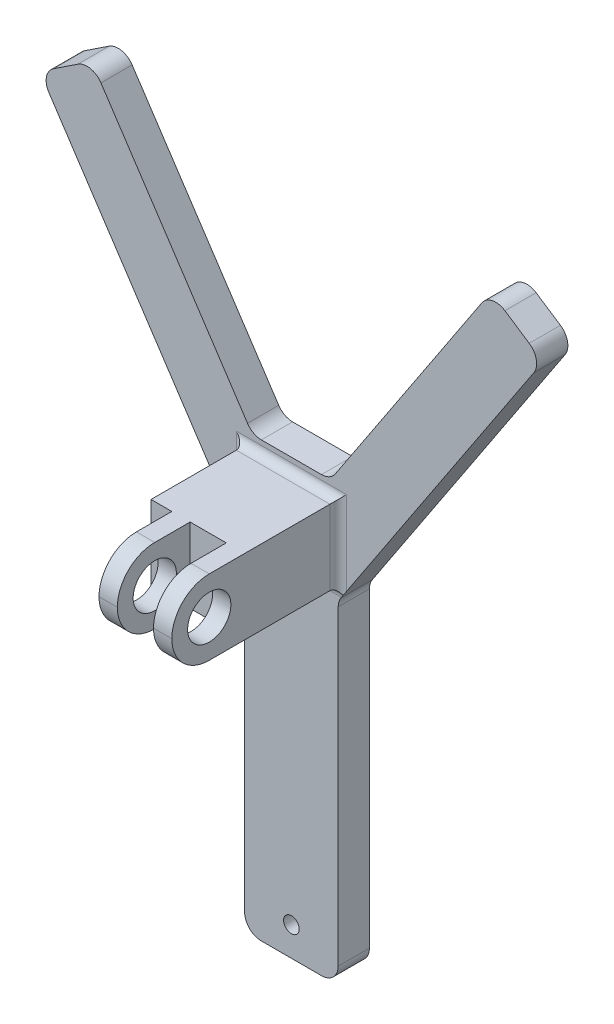
from build123d import *

# Parameters (mm, degrees)
BOSS_EXTRUDE1_DEPTH = 9.525
SKETCH3_W           = 28.575
SKETCH3_H           = 22.86
BOSS_EXTRUDE2_DEPTH = 50.8
FILLET1_R           = 5.08
SKETCH4_W           = 6.35
SKETCH4_H           = 22.225
SKETCH4_W_2         = 11.049
CUT_EXTRUDE1_DEPTH  = 143.837889922
FILLET3_R           = 11.43
SKETCH5_R           = 6.604
CUT_EXTRUDE2_DEPTH  = 172.690359797
SKETCH7_R           = 4.233333333
CUT_EXTRUDE3_DEPTH  = 5.08
SKETCH8_R           = 2.38125
CUT_EXTRUDE4_DEPTH  = 167.248859845
FILLET7_R           = 2.54


# Some blends are built 0.0001 mm under size
with BuildPart() as part:
    # Sketch1 → Boss-Extrude1 (new body)
    with BuildSketch(Plane.XY):
        Polygon((-11.895004803, 65.589219752), (11.895004803, 65.589219752), (60.958729286, 139.723968283), (76.844746829, 129.210313037), (14.2875, 34.687000521), (14.2875, -66.912999479), (-14.2875, -66.912999479), (-14.2875, 34.687000521), (-76.844746829, 129.210313037), (-60.958729286, 139.723968283), align=None)
    extrude(amount=BOSS_EXTRUDE1_DEPTH)

    # Sketch3 → Boss-Extrude2 (add)
    with BuildSketch(Plane.XY.offset(9.525)):
        with Locations((0, 50.138110136)):
            Rectangle(SKETCH3_W, SKETCH3_H)
    extrude(amount=BOSS_EXTRUDE2_DEPTH)

    # Fillet1
    fillet1_edges = [part.edges().sort_by_distance(p)[0] for p in [
        (-11.895004803, 65.589219752, 4.7625),
        (11.895004803, 65.589219752, 4.7625),
        (60.958729286, 139.723968283, 4.7625),
        (76.844746829, 129.210313037, 4.7625),
        (14.2875, 34.687000521, 4.7625),
        (14.2875, -66.912999479, 4.7625),
        (-14.2875, -66.912999479, 4.7625),
        (-14.2875, 34.687000521, 4.7625),
        (-76.844746829, 129.210313037, 4.7625),
        (-60.958729286, 139.723968283, 4.7625),
    ]]
    fillet(fillet1_edges, radius=FILLET1_R)

    # Sketch4 → Cut-Extrude1 (cut, through all)
    with BuildSketch(Plane.XZ.offset(-38.708110136)):
        with Locations((-11.1125, 49.2125)):
            Rectangle(SKETCH4_W, SKETCH4_H)
        with Locations((3.175, 49.2125)):
            Rectangle(SKETCH4_W_2, SKETCH4_H)
    extrude(amount=-CUT_EXTRUDE1_DEPTH, mode=Mode.SUBTRACT)

    # Fillet3
    fillet3_edges = [part.edges().sort_by_distance(p)[0] for p in [
        (11.4935, 61.568110136, 60.325),
        (-5.1435, 61.568110136, 60.325),
        (11.4935, 38.708110136, 60.325),
        (-5.1435, 38.708110136, 60.325),
    ]]
    fillet(fillet3_edges, radius=FILLET3_R - 0.0001)  # a hair under: the kernel refuses the full size

    # Sketch5 → Cut-Extrude2 (cut, through all)
    with BuildSketch(Plane.ZY.offset(7.9375)):
        with Locations(Location((48.895, 50.138110136, 0), (0, 0, 270))):
            Circle(SKETCH5_R)
    extrude(amount=-CUT_EXTRUDE2_DEPTH, mode=Mode.SUBTRACT)

    # Sketch7 → Cut-Extrude3 (cut)
    with BuildSketch(Plane(origin=(0, 0, 0), x_dir=(-1, 0, 0), z_dir=(0, 0, -1))):
        with Locations((0, -58.022999479)):
            Circle(SKETCH7_R)
    extrude(amount=-CUT_EXTRUDE3_DEPTH, mode=Mode.SUBTRACT)

    # Sketch8 → Cut-Extrude4 (cut, through all)
    with BuildSketch(Plane(origin=(0, 0, 5.08), x_dir=(-1, 0, 0), z_dir=(0, 0, -1))):
        with Locations((0, -58.022999479)):
            Circle(SKETCH8_R)
    extrude(amount=-CUT_EXTRUDE4_DEPTH, mode=Mode.SUBTRACT)

    # Fillet7
    # the kernel refuses this fillet: 2.54 mm, written as the material it adds along each edge
    with BuildSketch(Plane(origin=(-14.2875, 38.708110136, 9.525), x_dir=(0, 0, 1), z_dir=(0, 1, 0))) as fillet7_piece_1:
        with BuildLine():
            CenterArc((FILLET7_R, -FILLET7_R), FILLET7_R, 90, 90)
            Line((0, -FILLET7_R), (0, 0))
            Line((0, 0), (FILLET7_R, 0))
        make_face()
    extrude(amount=22.86)
    with BuildSketch(Plane(origin=(14.2875, 38.708110136, 9.525), x_dir=(0, 0, 1), z_dir=(-1, 0, 0))) as fillet7_piece_2:
        with BuildLine():
            CenterArc((FILLET7_R, -FILLET7_R), FILLET7_R, 90, 90)
            Line((0, -FILLET7_R), (0, 0))
            Line((0, 0), (FILLET7_R, 0))
        make_face()
    extrude(amount=28.575)
    with BuildSketch(Plane(origin=(14.2875, 61.568110136, 9.525), x_dir=(1, 0, 0), z_dir=(0, -1, 0))) as fillet7_piece_3:
        with BuildLine():
            CenterArc((FILLET7_R, FILLET7_R), FILLET7_R, 180, 90)
            Line((0, FILLET7_R), (0, 0))
            Line((0, 0), (FILLET7_R, 0))
        make_face()
    extrude(amount=22.86)
    with BuildSketch(Plane(origin=(-14.2875, 61.568110136, 9.525), x_dir=(0, 1, 0), z_dir=(1, 0, 0))) as fillet7_piece_4:
        with BuildLine():
            CenterArc((FILLET7_R, FILLET7_R), FILLET7_R, 180, 90)
            Line((0, FILLET7_R), (0, 0))
            Line((0, 0), (FILLET7_R, 0))
        make_face()
    extrude(amount=28.575)
    with BuildSketch(Plane(origin=(14.2875, 38.708110136, 9.525), x_dir=(0, 0, 1), z_dir=(-1, 0, 0))) as fillet7_piece_5a_section:
        with BuildLine():
            CenterArc((FILLET7_R, -FILLET7_R), FILLET7_R, 90, 90)
            Line((0, -FILLET7_R), (0, 0))
            Line((0, 0), (FILLET7_R, 0))
        make_face()
    fillet7_piece_5a = extrude(amount=34.925, mode=Mode.PRIVATE)
    fillet7_piece_5a = split(fillet7_piece_5a, bisect_by=Plane(origin=(-14.2875, 38.220078421, 10.151447049), z_dir=(-1, 0, 0)), keep=Keep.TOP, mode=Mode.PRIVATE)
    fillet7_piece_5a = split(fillet7_piece_5a, bisect_by=Plane(origin=(-16.26964909, 37.682006014, 10.151447049), z_dir=(0.8339116820223069, 0.5518979131929445, 0)), keep=Keep.TOP, mode=Mode.PRIVATE)
    with BuildSketch(Plane(origin=(-14.2875, 32.358110136, 9.525), x_dir=(0, 0, 1), z_dir=(0, 1, 0))) as fillet7_piece_5b_section:
        with BuildLine():
            CenterArc((FILLET7_R, -FILLET7_R), FILLET7_R, 90, 90)
            Line((0, -FILLET7_R), (0, 0))
            Line((0, 0), (FILLET7_R, 0))
        make_face()
    fillet7_piece_5b = extrude(amount=29.21, mode=Mode.PRIVATE)
    fillet7_piece_5b = split(fillet7_piece_5b, bisect_by=Plane(origin=(-14.718813993, 38.708110136, 10.184953821), z_dir=(0, -1, 0)), keep=Keep.TOP, mode=Mode.PRIVATE)
    fillet7_piece_5b = split(fillet7_piece_5b, bisect_by=Plane(origin=(-15.49417016, 36.510265873, 10.184953821), z_dir=(0.8339116820223069, 0.5518979131929445, 0)), keep=Keep.TOP, mode=Mode.PRIVATE)
    fillet7_piece_5 = fillet7_piece_5a & fillet7_piece_5b
    add(fillet7_piece_5)
    with BuildSketch(Plane(origin=(-14.2875, 38.708110136, 9.525), x_dir=(0, 0, 1), z_dir=(0, 1, 0))) as fillet7_piece_6a_section:
        with BuildLine():
            CenterArc((FILLET7_R, -FILLET7_R), FILLET7_R, 90, 90)
            Line((0, -FILLET7_R), (0, 0))
            Line((0, 0), (FILLET7_R, 0))
        make_face()
    fillet7_piece_6a = extrude(amount=29.21, mode=Mode.PRIVATE)
    fillet7_piece_6a = split(fillet7_piece_6a, bisect_by=Plane(origin=(-14.86254359, 61.568110136, 10.10004359), z_dir=(0, 1, 0)), keep=Keep.TOP, mode=Mode.PRIVATE)
    with BuildSketch(Plane(origin=(-20.6375, 61.568110136, 9.525), x_dir=(0, 1, 0), z_dir=(1, 0, 0))) as fillet7_piece_6b_section:
        with BuildLine():
            CenterArc((FILLET7_R, FILLET7_R), FILLET7_R, 180, 90)
            Line((0, FILLET7_R), (0, 0))
            Line((0, 0), (FILLET7_R, 0))
        make_face()
    fillet7_piece_6b = extrude(amount=34.925, mode=Mode.PRIVATE)
    fillet7_piece_6b = split(fillet7_piece_6b, bisect_by=Plane(origin=(-14.2875, 62.143153727, 10.10004359), z_dir=(-1, 0, 0)), keep=Keep.TOP, mode=Mode.PRIVATE)
    fillet7_piece_6 = fillet7_piece_6a & fillet7_piece_6b
    add(fillet7_piece_6)
    with BuildSketch(Plane(origin=(20.6375, 38.708110136, 9.525), x_dir=(0, 0, 1), z_dir=(-1, 0, 0))) as fillet7_piece_7a_section:
        with BuildLine():
            CenterArc((FILLET7_R, -FILLET7_R), FILLET7_R, 90, 90)
            Line((0, -FILLET7_R), (0, 0))
            Line((0, 0), (FILLET7_R, 0))
        make_face()
    fillet7_piece_7a = extrude(amount=34.925, mode=Mode.PRIVATE)
    fillet7_piece_7a = split(fillet7_piece_7a, bisect_by=Plane(origin=(14.2875, 38.220078421, 10.151447049), z_dir=(1, 0, 0)), keep=Keep.TOP, mode=Mode.PRIVATE)
    fillet7_piece_7a = split(fillet7_piece_7a, bisect_by=Plane(origin=(16.26964909, 37.682006014, 10.151447049), z_dir=(-0.8339116820223068, 0.5518979131929448, 0)), keep=Keep.TOP, mode=Mode.PRIVATE)
    with BuildSketch(Plane(origin=(14.2875, 61.568110136, 9.525), x_dir=(1, 0, 0), z_dir=(0, -1, 0))) as fillet7_piece_7b_section:
        with BuildLine():
            CenterArc((FILLET7_R, FILLET7_R), FILLET7_R, 180, 90)
            Line((0, FILLET7_R), (0, 0))
            Line((0, 0), (FILLET7_R, 0))
        make_face()
    fillet7_piece_7b = extrude(amount=29.21, mode=Mode.PRIVATE)
    fillet7_piece_7b = split(fillet7_piece_7b, bisect_by=Plane(origin=(14.718813993, 38.708110136, 10.184953821), z_dir=(0, -1, 0)), keep=Keep.TOP, mode=Mode.PRIVATE)
    fillet7_piece_7b = split(fillet7_piece_7b, bisect_by=Plane(origin=(15.49417016, 36.510265872, 10.184953821), z_dir=(-0.8339116820223068, 0.5518979131929448, 0)), keep=Keep.TOP, mode=Mode.PRIVATE)
    fillet7_piece_7 = fillet7_piece_7a & fillet7_piece_7b
    add(fillet7_piece_7)
    with BuildSketch(Plane(origin=(14.2875, 67.918110136, 9.525), x_dir=(1, 0, 0), z_dir=(0, -1, 0))) as fillet7_piece_8a_section:
        with BuildLine():
            CenterArc((FILLET7_R, FILLET7_R), FILLET7_R, 180, 90)
            Line((0, FILLET7_R), (0, 0))
            Line((0, 0), (FILLET7_R, 0))
        make_face()
    fillet7_piece_8a = extrude(amount=29.21, mode=Mode.PRIVATE)
    fillet7_piece_8a = split(fillet7_piece_8a, bisect_by=Plane(origin=(14.86254359, 61.568110136, 10.10004359), z_dir=(0, 1, 0)), keep=Keep.TOP, mode=Mode.PRIVATE)
    with BuildSketch(Plane(origin=(-14.2875, 61.568110136, 9.525), x_dir=(0, 1, 0), z_dir=(1, 0, 0))) as fillet7_piece_8b_section:
        with BuildLine():
            CenterArc((FILLET7_R, FILLET7_R), FILLET7_R, 180, 90)
            Line((0, FILLET7_R), (0, 0))
            Line((0, 0), (FILLET7_R, 0))
        make_face()
    fillet7_piece_8b = extrude(amount=34.925, mode=Mode.PRIVATE)
    fillet7_piece_8b = split(fillet7_piece_8b, bisect_by=Plane(origin=(14.2875, 62.143153727, 10.10004359), z_dir=(1, 0, 0)), keep=Keep.TOP, mode=Mode.PRIVATE)
    fillet7_piece_8 = fillet7_piece_8a & fillet7_piece_8b
    add(fillet7_piece_8)


solid = part.part
